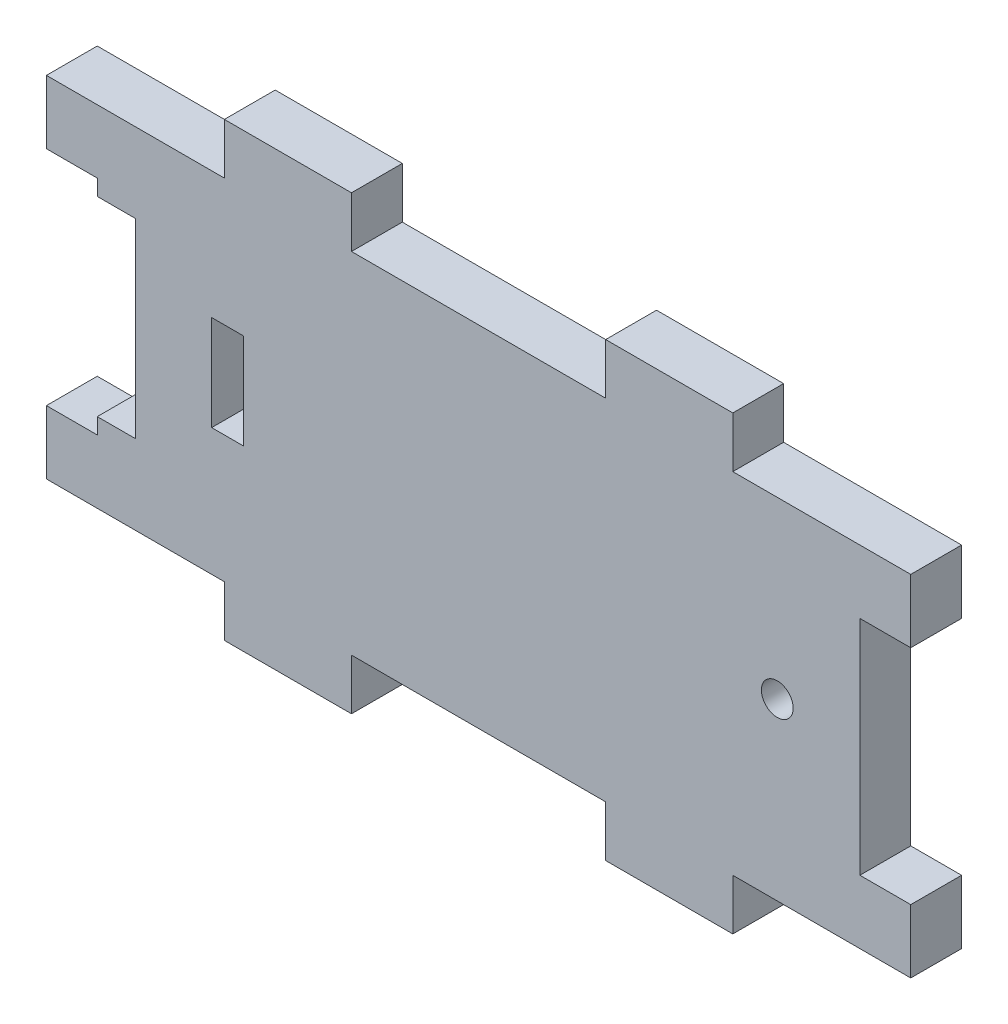
from build123d import *

# Parameters (mm, degrees)
SKETCH1_W           = 120
SKETCH1_H           = 55
SKETCH1_R           = 2.5
SKETCH1_W_2         = 5
SKETCH1_H_2         = 15
BOSS_EXTRUDE1_DEPTH = 8
CUT_EXTRUDE1_REACH  = 68.485
SKETCH2_W           = 38.750815327
SKETCH2_H           = 30
SKETCH4_W           = 8
SKETCH4_H           = 10
BOSS_EXTRUDE3_DEPTH = 8
SKETCH6_W           = 20
SKETCH6_H           = 8
BOSS_EXTRUDE4_DEPTH = 8


with BuildPart() as part:
    # Sketch1 → Boss-Extrude1 (new body)
    with BuildSketch(Plane.XY):
        Rectangle(SKETCH1_W, SKETCH1_H)
        with Locations((47, 0)):
            Circle(SKETCH1_R, mode=Mode.SUBTRACT)
        with Locations((-39.5, 0)):
            Rectangle(SKETCH1_W_2, SKETCH1_H_2, mode=Mode.SUBTRACT)
    extrude(amount=BOSS_EXTRUDE1_DEPTH)

    # Sketch2 → Cut-Extrude1 (cut, up to next)
    with BuildSketch(Plane.XY.offset(8), mode=Mode.PRIVATE) as cut_extrude1_sk1:
        with Locations((-73.375407663, 0)):
            Rectangle(SKETCH2_W, SKETCH2_H)
    cut_extrude1_tool1 = extrude(cut_extrude1_sk1.sketch, amount=-CUT_EXTRUDE1_REACH, mode=Mode.PRIVATE) & part.part
    add(cut_extrude1_tool1.solids().sort_by_distance((-73.375408, 0, 8))[0], mode=Mode.SUBTRACT)

    # Sketch4 → Boss-Extrude3 (add)
    with BuildSketch(Plane(origin=(60, 0, 0), x_dir=(0, 0, -1), z_dir=(1, 0, 0))):
        with Locations((-4, 22.5)):
            Rectangle(SKETCH4_W, SKETCH4_H)
        with Locations((-4, -22.5)):
            Rectangle(SKETCH4_W, SKETCH4_H)
    boss_extrude3 = extrude(amount=BOSS_EXTRUDE3_DEPTH)

    # Sketch6 → Boss-Extrude4 (add)
    with BuildSketch(Plane.XZ.offset(27.5)):
        with Locations((-30, 4)):
            Rectangle(SKETCH6_W, SKETCH6_H)
        with Locations((30, 4)):
            Rectangle(SKETCH6_W, SKETCH6_H)
    boss_extrude4 = extrude(amount=BOSS_EXTRUDE4_DEPTH)

    # Mirror2: Boss-Extrude4 across plane
    add(boss_extrude4.mirror(Plane(origin=(0, 0, 0), x_dir=(0, 0, 1), z_dir=(0, -1, 0))))

    # Mirror3: Boss-Extrude3 across plane
    add(boss_extrude3.mirror(Plane.ZY))


solid = part.part
